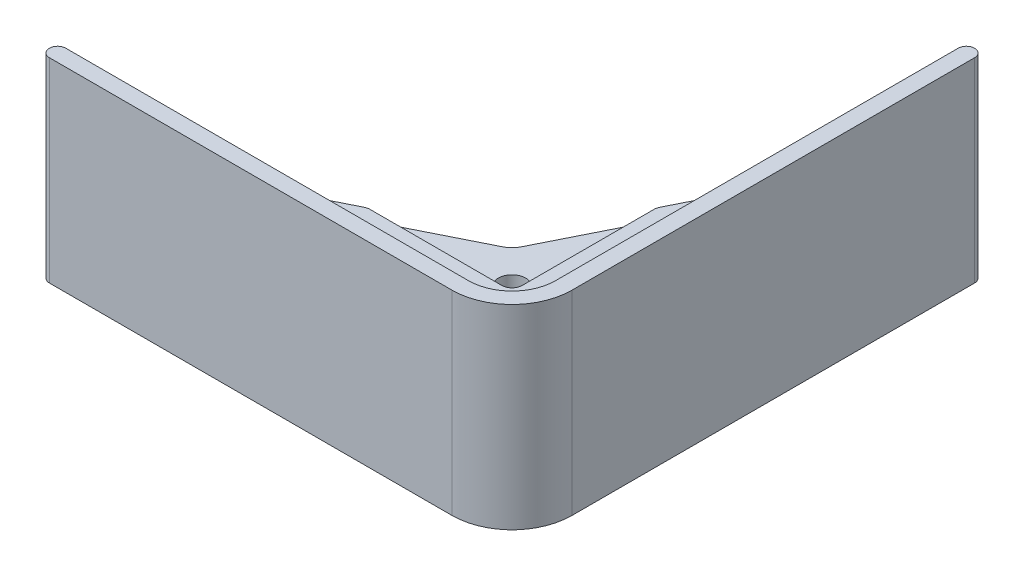
from build123d import *

# Parameters (mm, degrees)
SKETCH1_R           = 4.28625
BOSS_EXTRUDE1_DEPTH = 50.8
FILLET2_R           = 2.54
SKETCH7_W           = 44.675933609
SKETCH7_H           = 44.675933609
CUT_EXTRUDE3_DEPTH  = 3.429
FILLET9_R           = 3.175
BOSS_EXTRUDE2_DEPTH = 30.1625
FILLET10_R          = 6.35


with BuildPart() as part:
    # Sketch1 → Boss-Extrude1 (new body)
    with BuildSketch(Plane(origin=(0, 0, 0), x_dir=(1, 0, 0), z_dir=(0, 1, 0))):
        with BuildLine():
            Line((13.462, 57.17106993), (-10.037787665, 10.037787665))
            Line((-10.037787665, 10.037787665), (-57.17106993, -13.462))
            Line((-57.17106993, -13.462), (-127, -13.462))
            Line((-127, -13.462), (-127, -18.542))
            Line((-127, -18.542), (0, -18.542))
            ThreePointArc((0, -18.542), (13.111173937, -13.111173937), (18.542, 0))
            Line((18.542, 0), (18.542, 127))
            Line((18.542, 127), (13.462, 127))
            Line((13.462, 127), (13.462, 57.17106993))
        make_face()
        with Locations(Location((0, 0, 0), (0, 0, 270))):
            Circle(SKETCH1_R, mode=Mode.SUBTRACT)
    extrude(amount=BOSS_EXTRUDE1_DEPTH)

    # Fillet2
    fillet2_edges = [part.edges().sort_by_distance(p)[0] for p in [
        (13.462, 25.4, -127),
        (18.542, 25.4, -127),
        (-127, 25.4, 13.462),
        (-127, 25.4, 18.542),
    ]]
    fillet(fillet2_edges, radius=FILLET2_R - 0.0001)  # a hair under: the kernel refuses the full size

    # Sketch7 → Cut-Extrude3 (cut)
    with BuildSketch(Plane(origin=(0, 50.8, 0), x_dir=(1, 0, 0), z_dir=(0, 1, 0))):
        with Locations((-17.511966805, 17.511966805)):
            Rectangle(SKETCH7_W, SKETCH7_H)
    extrude(amount=-CUT_EXTRUDE3_DEPTH, mode=Mode.SUBTRACT)

    # Fillet9
    fillet9_edges = [part.edges().sort_by_distance(p)[0] for p in [
        (4.826, 49.0855, -39.849933609),
        (4.826, 49.0855, 4.826),
        (-39.849933609, 49.0855, 4.826),
    ]]
    fillet(fillet9_edges, radius=FILLET9_R)

    # Sketch8 → Boss-Extrude2 (add, symmetric)
    with BuildSketch(Plane(origin=(0, 25.4, 0), x_dir=(1, 0, 0), z_dir=(0, 1, 0))):
        with BuildLine():
            Line((0, -13.462), (-124.46, -13.462))
            ThreePointArc((-124.46, -13.462), (-126.256051224, -14.205948776), (-127, -16.002))
            ThreePointArc((-127, -16.002), (-126.256051224, -17.798051224), (-124.46, -18.542))
            Line((-124.46, -18.542), (0, -18.542))
            ThreePointArc((0, -18.542), (13.111173937, -13.111173937), (18.542, 0))
            Line((18.542, 0), (18.542, 124.46))
            ThreePointArc((18.542, 124.46), (17.798051224, 126.256051224), (16.002, 127))
            ThreePointArc((16.002, 127), (14.205948776, 126.256051224), (13.462, 124.46))
            Line((13.462, 124.46), (13.462, 0))
            ThreePointArc((13.462, 0), (9.519071488, -9.519071488), (0, -13.462))
        make_face()
    extrude(amount=BOSS_EXTRUDE2_DEPTH, both=True)

    # Fillet10
    fillet10_edges = [part.edges().sort_by_distance(p)[0] for p in [
        (13.462, 25.4, -57.17106993),
        (-57.17106993, 25.4, 13.462),
        (-10.037787665, 23.6855, -10.037787665),
    ]]
    fillet(fillet10_edges, radius=FILLET10_R)


solid = part.part
